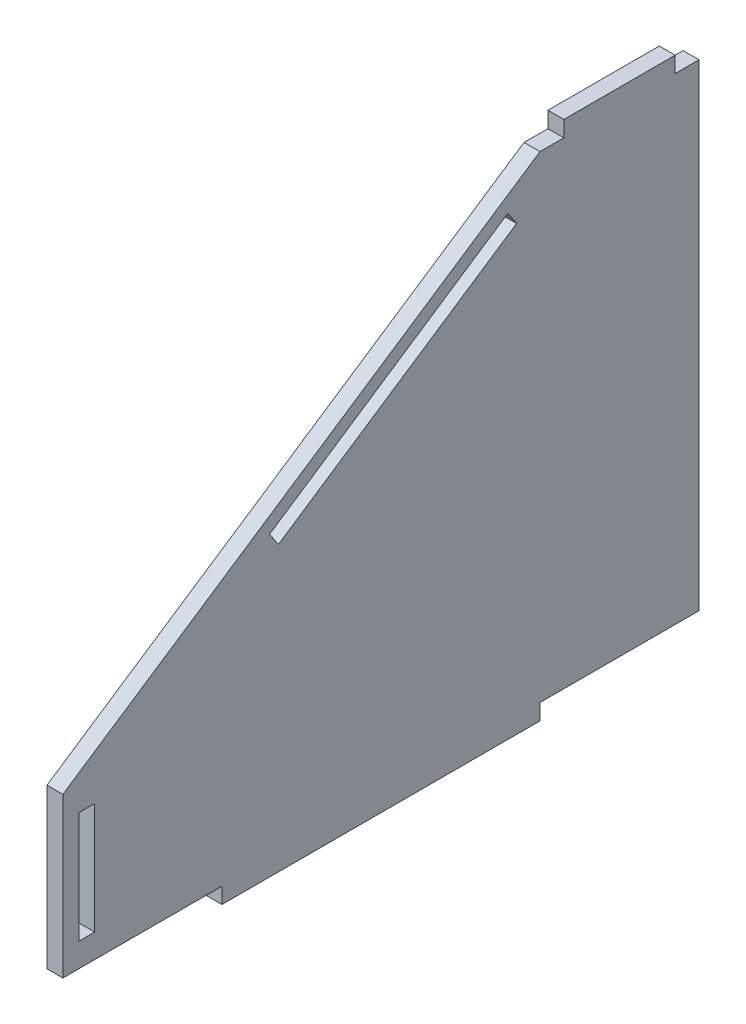
from build123d import *

# Parameters (mm, degrees)
CROQUIS1_W              = 5
CROQUIS1_H              = 35
SALIENTE_EXTRUIR1_DEPTH = 5


with BuildPart() as part:
    # Croquis1 → Saliente-Extruir1 (new body)
    with BuildSketch(Plane(origin=(0, 0, 0), x_dir=(0, 0, -1), z_dir=(1, 0, 0))):
        Polygon((150, 150), (0, 50), (0, 0), (50, 0), (50, -5), (150, -5), (150, 0), (200, 0), (200, 150), (192.5, 150), (192.5, 155), (157.5, 155), (157.5, 150), align=None)
        with Locations((7.5, 25)):
            Rectangle(CROQUIS1_W, CROQUIS1_H, mode=Mode.SUBTRACT)
        Polygon((65, 88.333333333), (139.88452649, 138.256350994), (142.658027472, 134.096099522), (67.773500981, 84.173081862), align=None, mode=Mode.SUBTRACT)
    extrude(amount=SALIENTE_EXTRUIR1_DEPTH)


solid = part.part
